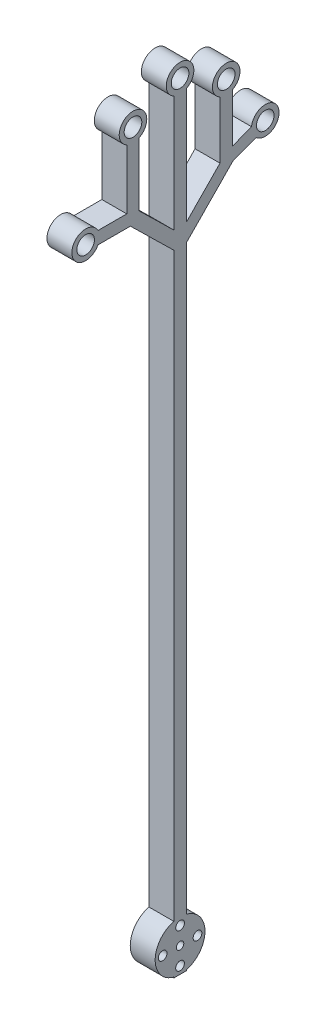
from build123d import *

# Parameters (mm, degrees)
SKETCH1_W           = 5
SKETCH1_H           = 250
BOSS_EXTRUDE1_DEPTH = 10
SKETCH3_R           = 10
BOSS_EXTRUDE2_DEPTH = 10
SKETCH4_R           = 1.5
SKETCH4_R_2         = 1.75
CUT_EXTRUDE1_DEPTH  = 23
EXTRUDE_THIN5_START = -10
EXTRUDE_THIN5_DEPTH = 10
SKETCH10_W          = 5
SKETCH10_H          = 27.5
BOSS_EXTRUDE3_DEPTH = 10
BOSS_EXTRUDE4_DEPTH = 10
SKETCH12_R          = 5.535533906
SKETCH12_R_2        = 3.535533906
EXTRUDE_THIN6_DEPTH = 10
SKETCH14_R          = 3.535533906
CUT_EXTRUDE2_DEPTH  = 10


# Read off the part's stored shape, not the designer's step: Extrude-Thin5
with BuildPart() as part:
    # Sketch1 → Boss-Extrude1 (new body)
    with BuildSketch(Plane(origin=(0, 0, 0), x_dir=(0, 0, -1), z_dir=(1, 0, 0))):
        Rectangle(SKETCH1_W, SKETCH1_H)
    extrude(amount=BOSS_EXTRUDE1_DEPTH)

    # Sketch3 → Boss-Extrude2 (add)
    with BuildSketch(Plane.ZY):
        with Locations((0, -115)):
            Circle(SKETCH3_R)
    extrude(amount=-BOSS_EXTRUDE2_DEPTH)

    # Sketch4 → Cut-Extrude1 (cut)
    with BuildSketch(Plane.ZY):
        with Locations((0, -115)):
            Circle(SKETCH4_R)
        with Locations((-7, -115)):
            Circle(SKETCH4_R_2)
        with Locations((0, -108)):
            Circle(SKETCH4_R_2)
        with Locations((7, -115)):
            Circle(SKETCH4_R_2)
        with Locations((0, -122)):
            Circle(SKETCH4_R_2)
    extrude(amount=-CUT_EXTRUDE1_DEPTH, mode=Mode.SUBTRACT)

    # Extrude-Thin5 outline → Extrude-Thin5 (add)
    with BuildSketch(Plane(origin=(10, 0, 0), x_dir=(0, 0, -1), z_dir=(1, 0, 0)).offset(EXTRUDE_THIN5_START)):
        Polygon((17.451133042, 150.459060521), (2.5, 135.186573848), (2.5, 184.059108288), (-2.5, 184.059108288), (-2.5, 135.005040385), (-17.902207713, 150.083164962), (-21.399952233, 146.51024133), (-2.5, 128.007969476), (-2.5, 125), (2.5, 125), (2.5, 128.039110715), (21.024056673, 146.961316001), align=None)
    extrude(amount=EXTRUDE_THIN5_DEPTH)

    # Sketch10 → Boss-Extrude3 (add)
    with BuildSketch(Plane(origin=(10, 0, 0), x_dir=(0, 0, -1), z_dir=(1, 0, 0))):
        with Locations((18.524056673, 160.711316001)):
            Rectangle(SKETCH10_W, SKETCH10_H)
        Polygon((30.970200678, 156.21277045), (32.755260524, 151.542271403), (18.743763382, 146.187091867), (16.958703537, 150.857590914), align=None)
    extrude(amount=-BOSS_EXTRUDE3_DEPTH)

    # Sketch11 → Boss-Extrude4 (add)
    with BuildSketch(Plane(origin=(10, 0, 0), x_dir=(0, 0, -1), z_dir=(1, 0, 0))):
        Polygon((-21.399952233, 176.51024133), (-21.399952233, 150.083164962), (-17.902207713, 150.083164962), (-16.399952233, 148.612518954), (-16.399952233, 176.51024133), align=None)
        Polygon((-17.902207713, 150.083164962), (-21.399952233, 146.51024133), (-17.902207713, 146.51024133), align=None)
        Polygon((-21.399952233, 150.083164962), (-21.399952233, 146.51024133), (-17.902207713, 150.083164962), align=None)
        Polygon((-17.902207713, 150.083164962), (-17.902207713, 146.51024133), (-16.399952233, 146.51024133), (-16.399952233, 148.612518954), align=None)
        Polygon((-19.942202859, 145.083164962), (-21.399952233, 146.51024133), (-21.399952233, 150.083164962), (-35.402207713, 150.083164962), (-35.402207713, 145.083164962), align=None)
        Polygon((-17.902207713, 146.51024133), (-21.399952233, 146.51024133), (-19.942202859, 145.083164962), (-17.902207713, 145.083164962), align=None)
    extrude(amount=-BOSS_EXTRUDE4_DEPTH)

    # Sketch12 → Extrude-Thin6 (add)
    # profile 1 of 5: a face of its own
    with BuildSketch(Plane(origin=(10, 0, 0), x_dir=(0, 0, -1), z_dir=(1, 0, 0))):
        with Locations((-18.899952233, 179.01024133)):
            Circle(SKETCH12_R)
        with Locations((-18.899952233, 179.01024133)):
            Circle(SKETCH12_R_2, mode=Mode.SUBTRACT)
    # profile 2 of 5: a face of its own
    with BuildSketch(Plane(origin=(10, 0, 0), x_dir=(0, 0, -1), z_dir=(1, 0, 0))):
        with Locations((0, 186.559108288)):
            Circle(SKETCH12_R)
        with Locations((0, 186.559108288)):
            Circle(SKETCH12_R_2, mode=Mode.SUBTRACT)
    # profile 3 of 5: a face of its own
    with BuildSketch(Plane(origin=(10, 0, 0), x_dir=(0, 0, -1), z_dir=(1, 0, 0))):
        with Locations((18.524056673, 176.961316001)):
            Circle(SKETCH12_R)
        with Locations((18.524056673, 176.961316001)):
            Circle(SKETCH12_R_2, mode=Mode.SUBTRACT)
    # profile 4 of 5: a face of its own
    with BuildSketch(Plane(origin=(10, 0, 0), x_dir=(0, 0, -1), z_dir=(1, 0, 0))):
        with Locations((34.197980125, 154.770050849)):
            Circle(SKETCH12_R)
        with Locations((34.197980125, 154.770050849)):
            Circle(SKETCH12_R_2, mode=Mode.SUBTRACT)
    # profile 5 of 5: a face of its own
    with BuildSketch(Plane(origin=(10, 0, 0), x_dir=(0, 0, -1), z_dir=(1, 0, 0))):
        with Locations((-37.902207713, 147.583164962)):
            Circle(SKETCH12_R)
        with Locations((-37.902207713, 147.583164962)):
            Circle(SKETCH12_R_2, mode=Mode.SUBTRACT)
    extrude(amount=-EXTRUDE_THIN6_DEPTH)

    # Sketch14 → Cut-Extrude2 (cut)
    with BuildSketch(Plane(origin=(10, 0, 0), x_dir=(0, 0, -1), z_dir=(1, 0, 0))):
        with Locations((-37.902207713, 147.583164962)):
            Circle(SKETCH14_R)
        with Locations((-18.899952233, 179.01024133)):
            Circle(SKETCH14_R)
        with Locations((0, 186.559108288)):
            Circle(SKETCH14_R)
        with Locations((18.524056673, 176.961316001)):
            Circle(SKETCH14_R)
        with Locations((34.197980125, 154.770050849)):
            Circle(SKETCH14_R)
    extrude(amount=-CUT_EXTRUDE2_DEPTH, mode=Mode.SUBTRACT)


solid = part.part
